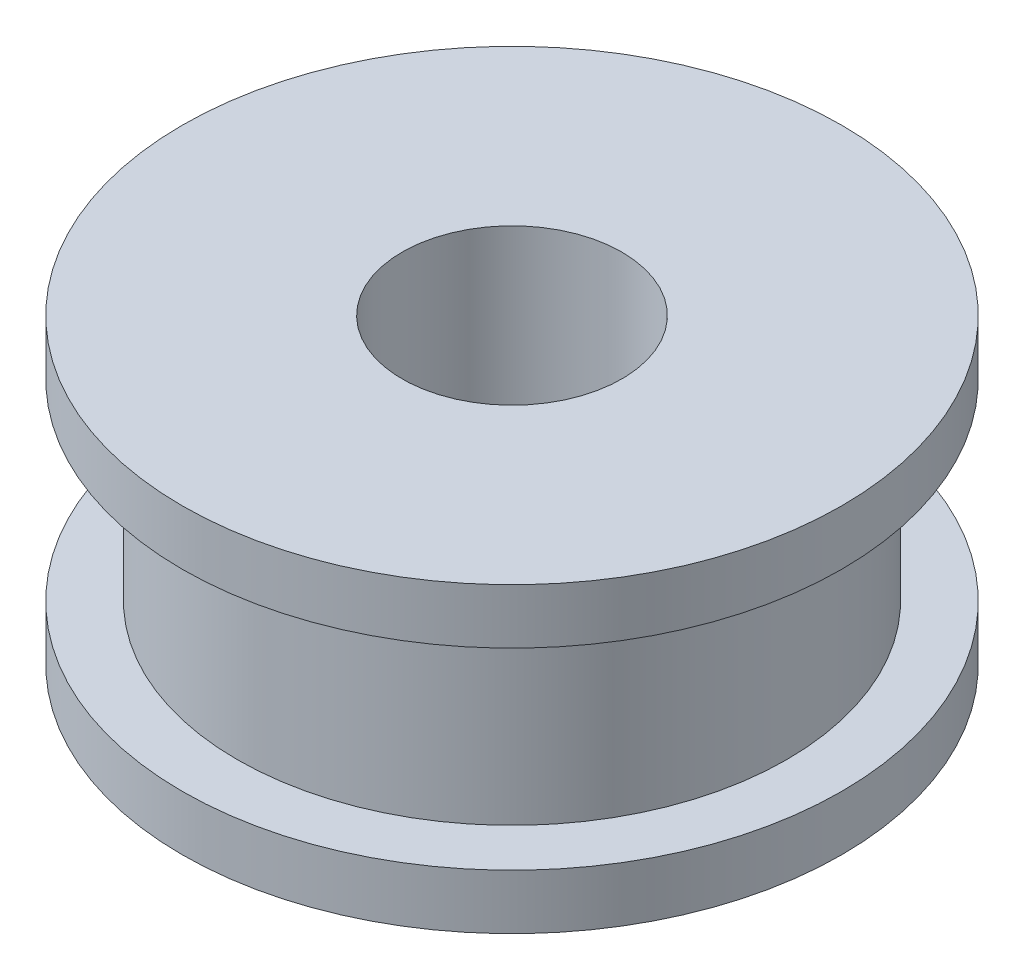
from build123d import *


with BuildPart() as part:
    # Sketch1 → Revolve1 (revolve)
    with BuildSketch(Plane.XY):
        Polygon((4, 11), (4, 0), (12, 0), (12, 2), (10, 2), (10, 9), (12, 9), (12, 11), align=None)
    revolve(axis=Axis((0, 0, 0), (0, 1, 0)))


solid = part.part
